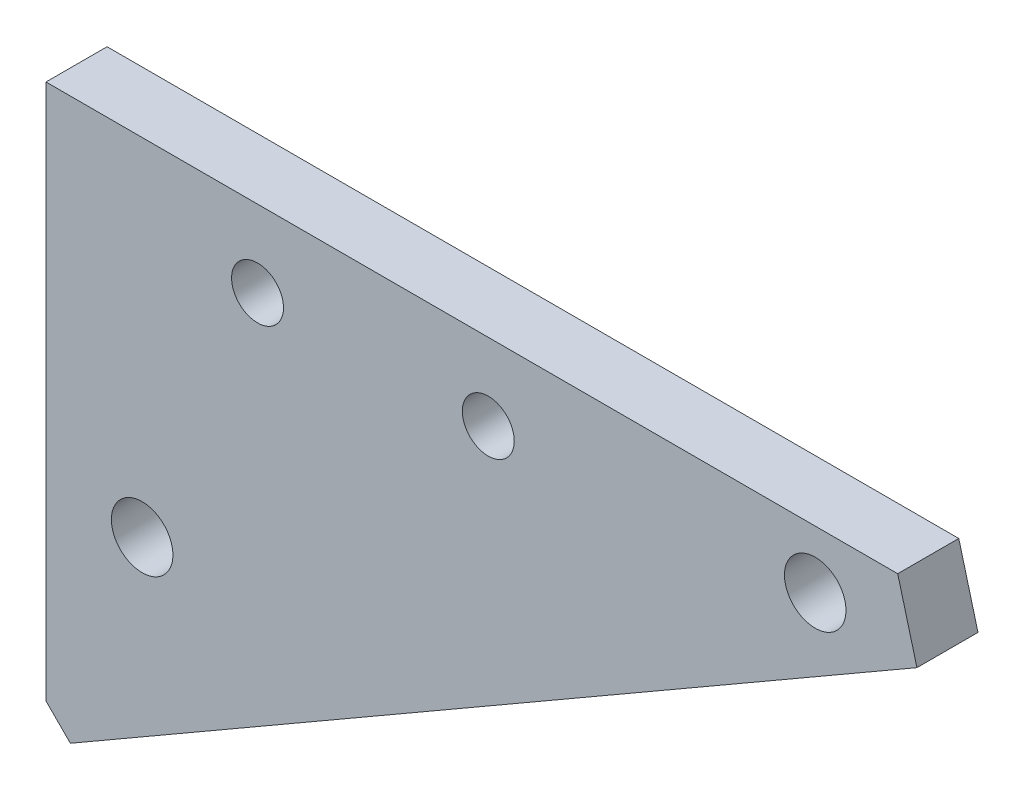
from build123d import *

# Parameters (mm, degrees)
BOSS_EXTRUDE1_DEPTH    = 3.175
M2_5_CLEARANCE_HOLE1_D = 2.7
CHAMFER1_SIZE          = 2
CHAMFER1_SIZE2         = 1.464101615
M3_CLEARANCE_HOLE1_D   = 3.2


with BuildPart() as part:
    # Sketch2 → Boss-Extrude1 (new body)
    with BuildSketch(Plane.XY):
        Polygon((17, 4), (-17, 4), (-17, -25.879909152), (34.753520778, 4), align=None)
    extrude(amount=BOSS_EXTRUDE1_DEPTH)

    # M2.5 Clearance Hole1 (through all)
    with Locations(Plane.XY.offset(3.175)):
        with Locations((-6, 0), (6, 0)):
            Hole(M2_5_CLEARANCE_HOLE1_D / 2)

    # Fillet1
    # the kernel refuses this chamfer: 2 mm, written as the material it takes off along each edge
    with BuildSketch(Plane(origin=(34.753520778, 4, -18.713015054), x_dir=(-0.9999467105068274, 0.01032357237467217, 0), z_dir=(0, 0, 1))) as fillet1_piece_1:
        with BuildLine():
            Line((7.485206022, 0), (6.403726885, 3.875640743))
            Line((6.403726885, 3.875640743), (6.383370332, 3.910073441))
            ThreePointArc((6.383370332, 3.910073441), (3.20116981, 1.938993637), (-0.020356553, 0.034432699))
            Line((-0.020356553, 0.034432699), (0.000412943, -0.039997868))
            ThreePointArc((0.000412943, -0.039997868), (3.742617081, -0.001362894), (7.485618964, -0.039997868))
            Line((7.485618964, -0.039997868), (7.485206022, 0))
        make_face()
    extrude(amount=40.601030108, mode=Mode.SUBTRACT)

    # Chamfer1
    chamfer1_edges = [part.edges().sort_by_distance(p)[0] for p in [
        (-17, -25.879909152, 1.5875),
    ]]
    chamfer1_side = [part.faces().sort_by_distance(p)[0] for p in [
        (-17, -10.939954576, 1.5875),
    ]]
    chamfer(chamfer1_edges, length=CHAMFER1_SIZE, length2=CHAMFER1_SIZE2, reference=chamfer1_side[0])

    # M3 Clearance Hole1 (through all)
    with Locations(Plane(origin=(0, 0, 0), x_dir=(-1, 0, 0), z_dir=(0, 0, -1))):
        with Locations((-23, 1), (12, -14)):
            Hole(M3_CLEARANCE_HOLE1_D / 2)


solid = part.part
